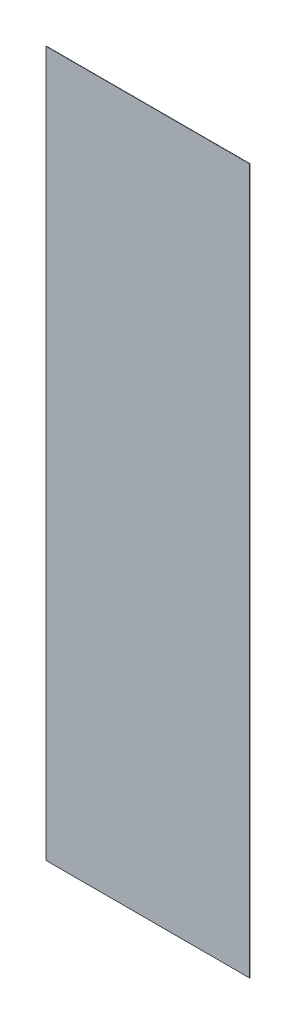
from build123d import *

# Parameters (mm, degrees)
BOSS_EXTRUDE1_DEPTH = 4810
CHAMFER1_SIZE       = 1


with BuildPart() as part:
    # Sketch3 → Boss-Extrude1 (new body)
    with BuildSketch(Plane(origin=(0, 0, 0), x_dir=(1, 0, 0), z_dir=(0, 1, 0))):
        Polygon((-693.76, 0), (693.76, 0), (694.337350269, 1), (-694.337350269, 1), align=None)
    extrude(amount=-BOSS_EXTRUDE1_DEPTH)

    # Chamfer1
    chamfer1_edges = [part.edges().sort_by_distance(p)[0] for p in [
        (0, 0, 0),
    ]]
    chamfer(chamfer1_edges, length=CHAMFER1_SIZE - 0.0001)  # a hair under: the kernel refuses the full size


solid = part.part
